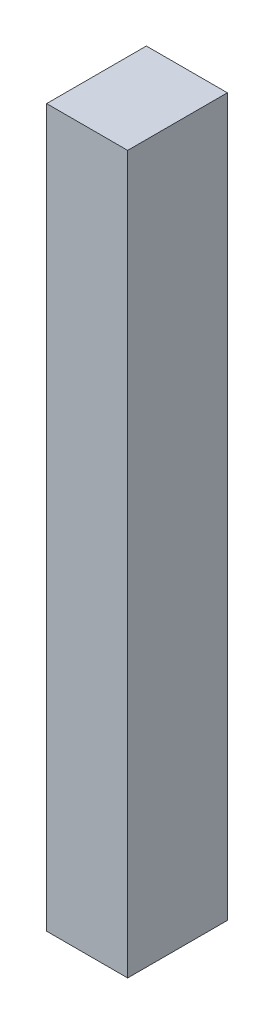
from build123d import *

# Parameters (mm, degrees)
SKETCH_1_W      = 32
SKETCH_1_H      = 230
EXTRUDE_1_DEPTH = 26


with BuildPart() as part:
    # Эскиз1 → Бобышка-Вытянуть1 (new body)
    with BuildSketch(Plane(origin=(0, 0, 0), x_dir=(0, 0, -1), z_dir=(1, 0, 0))):
        Rectangle(SKETCH_1_W, SKETCH_1_H)
    extrude(amount=EXTRUDE_1_DEPTH)


solid = part.part
